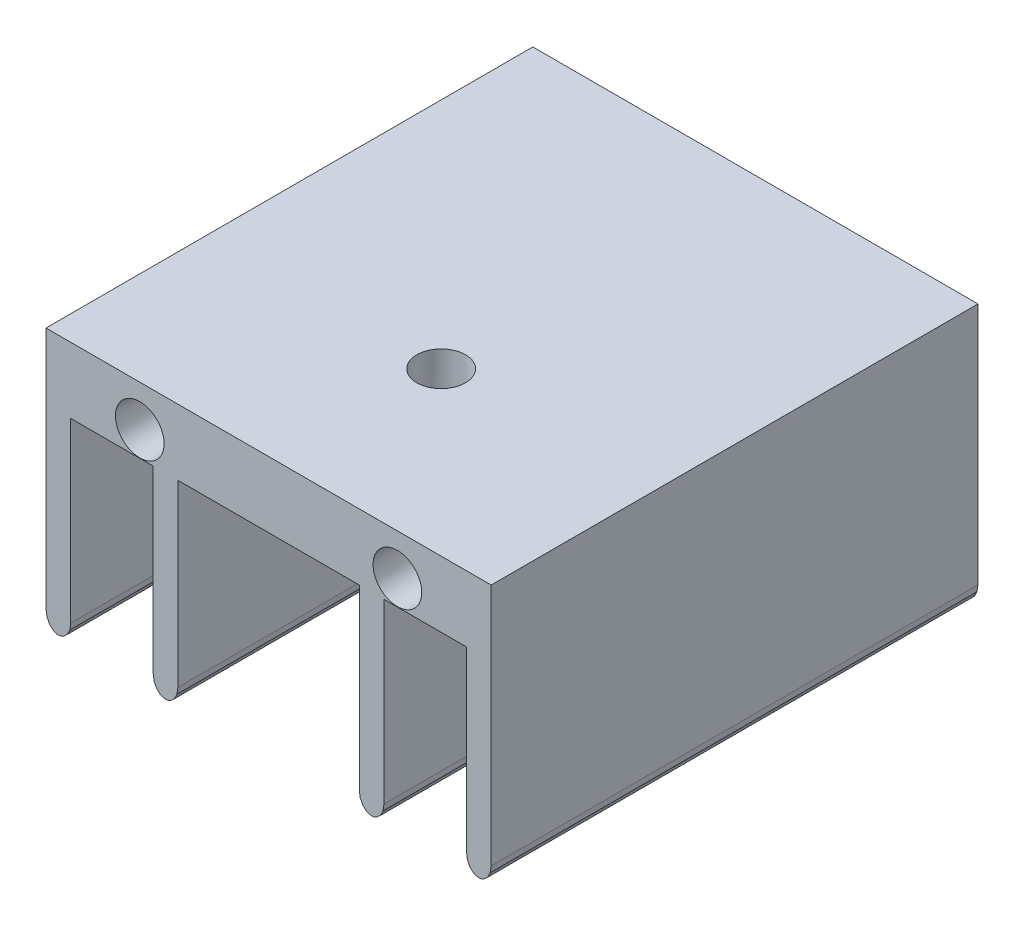
from build123d import *

# Parameters (mm, degrees)
RESSALTO_EXTRUS_O1_OUTLINE_R = 1.499997
RESSALTO_EXTRUS_O1_DEPTH     = 30
ESBO_O2_R                    = 1.5
CORTE_EXTRUS_O1_DEPTH        = 30


# Read off the part's stored shape, not the designer's step: Ressalto-extrusão1
with BuildPart() as part:
    # Ressalto-extrusão1 outline → Ressalto-extrusão1 (new body)
    with BuildSketch(Plane.XY):
        Polygon((-5.588, -17.863), (-5.588, -6.814), (5.588, -6.814), (5.588, -17.736), (5.646801, -18.1358468), (5.8082688, -18.4582998), (6.0501022, -18.6736156), (6.1941964, -18.7317816), (6.35, -18.752), (6.5058036, -18.7317816), (6.6498978, -18.6736156), (6.8917312, -18.4582998), (7.053199, -18.1358468), (7.112, -17.736), (7.112, -6.814), (12.192, -6.814), (12.192, -17.736), (12.250801, -18.1358468), (12.4122688, -18.4582998), (12.6541022, -18.6736156), (12.7981964, -18.7317816), (12.954, -18.752), (13.1098036, -18.7317816), (13.2538978, -18.6736156), (13.4957312, -18.4582998), (13.657199, -18.1358468), (13.716, -17.736), (13.716, -2.75), (-13.716, -2.75), (-13.716, -17.736), (-13.657199, -18.1358468), (-13.4957312, -18.4582998), (-13.2538978, -18.6736156), (-13.1098036, -18.7317816), (-12.954, -18.752), (-12.7981964, -18.7317816), (-12.6541022, -18.6736156), (-12.4122688, -18.4582998), (-12.250801, -18.1358468), (-12.192, -17.736), (-12.192, -6.814), (-7.112, -6.814), (-7.112, -17.863), (-7.053199, -18.2628468), (-6.8917312, -18.5852998), (-6.6498978, -18.8006156), (-6.5058036, -18.8587816), (-6.35, -18.879), (-6.1941964, -18.8587816), (-6.0501022, -18.8006156), (-5.8082688, -18.5852998), (-5.646801, -18.2628468), align=None)
        with Locations((-7.9375, -5.29)):
            Circle(RESSALTO_EXTRUS_O1_OUTLINE_R, mode=Mode.SUBTRACT)
        with Locations((7.9375, -5.29)):
            Circle(RESSALTO_EXTRUS_O1_OUTLINE_R, mode=Mode.SUBTRACT)
    extrude(amount=RESSALTO_EXTRUS_O1_DEPTH)

    # Esboço2 → Corte-extrusão1 (cut)
    with BuildSketch(Plane(origin=(0, -2.75, 0), x_dir=(1, 0, 0), z_dir=(0, 1, 0))):
        with Locations(Location((0.635, -20, 0), (0, 0, 270))):
            Circle(ESBO_O2_R)
    extrude(amount=-CORTE_EXTRUS_O1_DEPTH, mode=Mode.SUBTRACT)


solid = part.part
